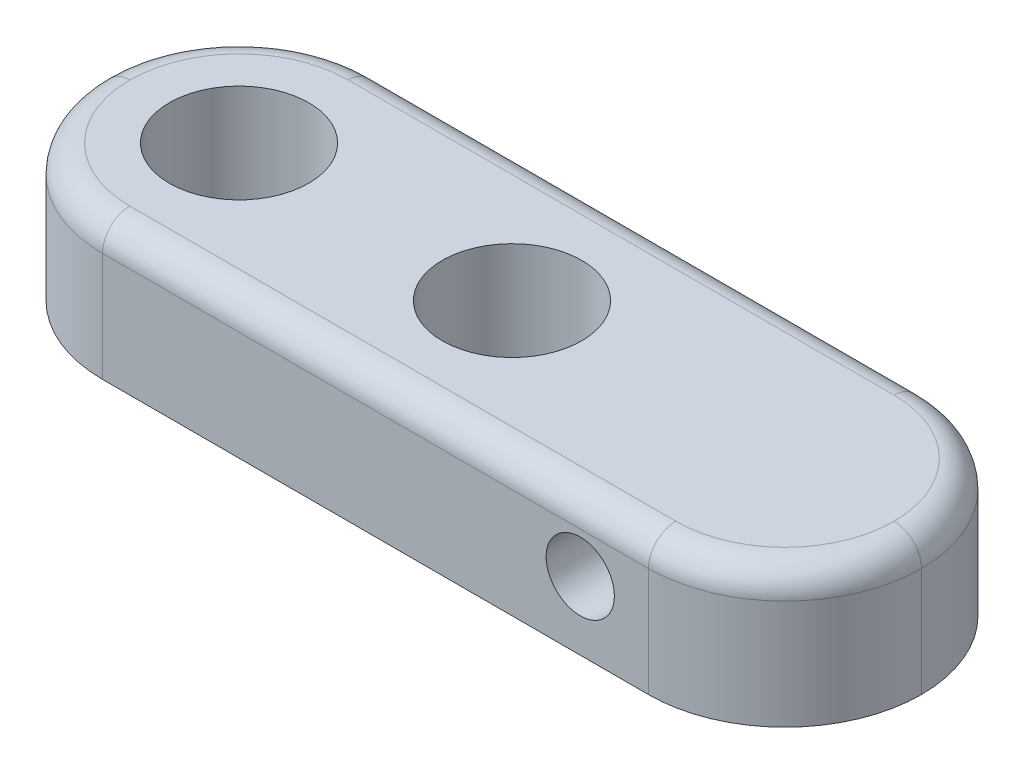
from build123d import *

# Parameters (mm, degrees)
SKETCH1_W           = 30
SKETCH1_H           = 10
SKETCH1_R           = 2.555
BOSS_EXTRUDE1_DEPTH = 5
SKETCH2_R           = 1.25
CUT_EXTRUDE1_DEPTH  = 28.386127875
CUT_EXTRUDE2_START  = -5
SKETCH2_3_R         = 1.25
CUT_EXTRUDE2_DEPTH  = 5
FILLET1_R           = 5
FILLET2_R           = 1


# Some blends are built 0.0001 mm under size
with BuildPart() as part:
    # Sketch1 → Boss-Extrude1 (new body)
    with BuildSketch(Plane(origin=(0, 0, 0), x_dir=(1, 0, 0), z_dir=(0, 1, 0))):
        with Locations((10, 0)):
            Rectangle(SKETCH1_W, SKETCH1_H)
        with Locations(Location((0, 0, 0), (0, 0, 270))):
            Circle(SKETCH1_R, mode=Mode.SUBTRACT)
        with Locations(Location((10, 0, 0), (0, 0, 270))):
            Circle(SKETCH1_R, mode=Mode.SUBTRACT)
    extrude(amount=BOSS_EXTRUDE1_DEPTH)

    # Sketch2 → Cut-Extrude1 (cut, through all)
    with BuildSketch(Plane.XY.offset(5)):
        with Locations((17.5, 2.5)):
            Circle(SKETCH2_R)
    extrude(amount=-CUT_EXTRUDE1_DEPTH, mode=Mode.SUBTRACT)

    # Sketch2<3> → Cut-Extrude2 (cut)
    with BuildSketch(Plane.XY.offset(5).offset(CUT_EXTRUDE2_START)):
        Polygon((18.625, 4.448557159), (16.375, 4.448557159), (15.25, 2.5), (16.375, 0.551442841), (18.625, 0.551442841), (19.75, 2.5), align=None)
        with Locations((17.5, 2.5)):
            Circle(SKETCH2_3_R, mode=Mode.SUBTRACT)
    extrude(amount=-CUT_EXTRUDE2_DEPTH, mode=Mode.SUBTRACT)

    # Fillet1
    fillet1_edges = [part.edges().sort_by_distance(p)[0] for p in [
        (-5, 2.5, -5),
        (-5, 2.5, 5),
        (25, 2.5, -5),
        (25, 2.5, 5),
    ]]
    fillet(fillet1_edges, radius=FILLET1_R - 0.0001)  # a hair under: the kernel refuses the full size

    # Fillet2
    # the kernel refuses this fillet: 1 mm, written as the material it takes off along each edge
    with BuildSketch(Plane(origin=(-0.0001, 5, 0.0001), x_dir=(-1, 0, 0), z_dir=(0, 0, -1))) as fillet2_piece_1:
        with BuildLine():
            CenterArc((4.9999 - FILLET2_R, -FILLET2_R), FILLET2_R, 0, 90)
            Line((4.9999, -FILLET2_R), (4.9999, 0))
            Line((4.9999, 0), (4.9999 - FILLET2_R, 0))
        make_face()
    revolve(axis=Axis((-0.0001, 5, 0.0001), (0, 1, 0)), revolution_arc=90, mode=Mode.SUBTRACT)
    with BuildSketch(Plane(origin=(-0.0001, 5, -0.0001), x_dir=(0, 0, -1), z_dir=(1, 0, 0))) as fillet2_piece_2:
        with BuildLine():
            CenterArc((4.9999 - FILLET2_R, -FILLET2_R), FILLET2_R, 0, 90)
            Line((4.9999 - FILLET2_R, 0), (4.9999, 0))
            Line((4.9999, 0), (4.9999, -FILLET2_R))
        make_face()
    revolve(axis=Axis((-0.0001, 5, -0.0001), (0, 1, 0)), revolution_arc=90, mode=Mode.SUBTRACT)
    with BuildSketch(Plane(origin=(-0.0001, 5, -5), x_dir=(0, -1, 0), z_dir=(1, 0, 0))) as fillet2_piece_3:
        with BuildLine():
            CenterArc((FILLET2_R, -FILLET2_R), FILLET2_R, 90, 90)
            Line((0, -FILLET2_R), (0, 0))
            Line((0, 0), (FILLET2_R, 0))
        make_face()
    extrude(amount=20.0002, mode=Mode.SUBTRACT)
    with BuildSketch(Plane(origin=(20.0001, 5, -0.0001), x_dir=(0, 0, -1), z_dir=(-1, 0, 0))) as fillet2_piece_4:
        with BuildLine():
            CenterArc((4.9999 - FILLET2_R, FILLET2_R), FILLET2_R, 270, 90)
            Line((4.9999 - FILLET2_R, 0), (4.9999, 0))
            Line((4.9999, 0), (4.9999, FILLET2_R))
        make_face()
    revolve(axis=Axis((20.0001, 5, -0.0001), (0, -1, 0)), revolution_arc=90, mode=Mode.SUBTRACT)
    with BuildSketch(Plane(origin=(20.0001, 5, 0.0001), x_dir=(1, 0, 0), z_dir=(0, 0, -1))) as fillet2_piece_5:
        with BuildLine():
            CenterArc((4.9999 - FILLET2_R, FILLET2_R), FILLET2_R, 270, 90)
            Line((4.9999, FILLET2_R), (4.9999, 0))
            Line((4.9999, 0), (4.9999 - FILLET2_R, 0))
        make_face()
    revolve(axis=Axis((20.0001, 5, 0.0001), (0, -1, 0)), revolution_arc=90, mode=Mode.SUBTRACT)
    with BuildSketch(Plane(origin=(20.0001, 5, 5), x_dir=(0, 0, -1), z_dir=(-1, 0, 0))) as fillet2_piece_6:
        with BuildLine():
            CenterArc((FILLET2_R, FILLET2_R), FILLET2_R, 180, 90)
            Line((0, FILLET2_R), (0, 0))
            Line((0, 0), (FILLET2_R, 0))
        make_face()
    extrude(amount=20.0002, mode=Mode.SUBTRACT)
    with BuildSketch(Plane(origin=(25, 5, -0.0001), x_dir=(-1, 0, 0), z_dir=(0, 0, 1)), Plane(origin=(-5, 5, 0.0001), x_dir=(1, 0, 0), z_dir=(0, 0, -1))) as fillet2_piece_7:
        with BuildLine():
            CenterArc((FILLET2_R, FILLET2_R), FILLET2_R, 180, 90)
            Line((0, FILLET2_R), (0, 0))
            Line((0, 0), (FILLET2_R, 0))
        make_face()
    extrude(amount=0.0002, mode=Mode.SUBTRACT)


solid = part.part
